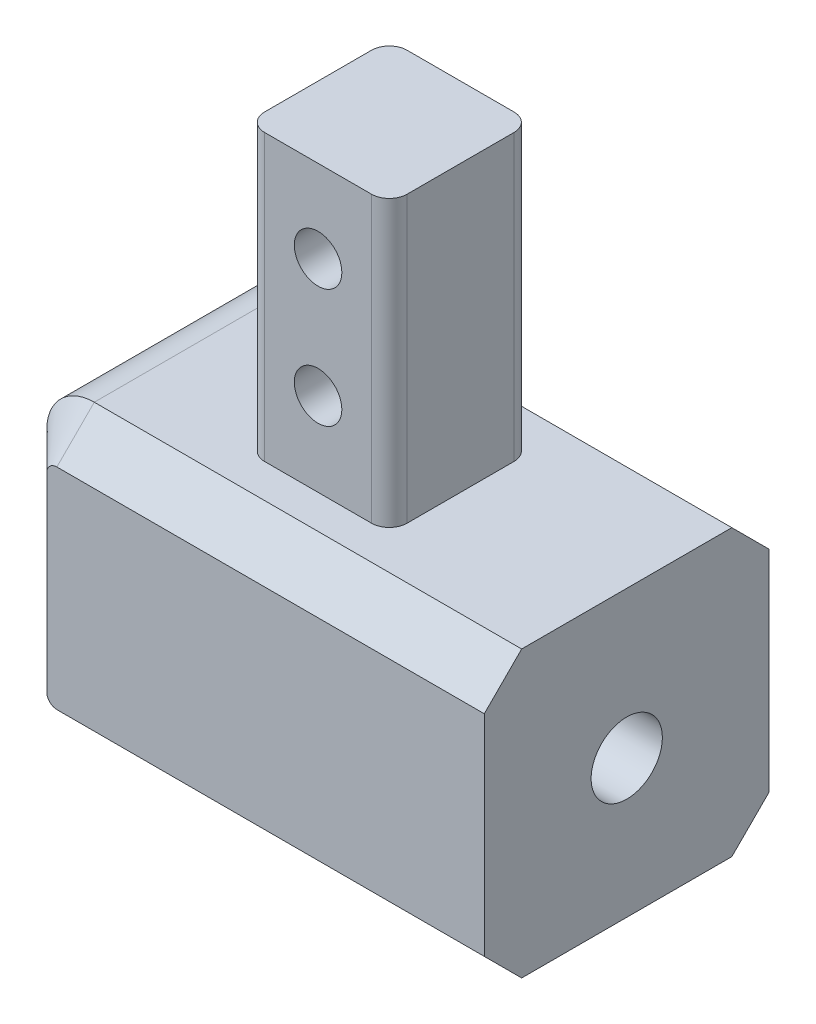
from build123d import *

# Parameters (mm, degrees)
SKETCH2_W                      = 127
SKETCH2_H                      = 76.2
BOSS_EXTRUDE2_DEPTH            = 76.2
FILLET1_R                      = 12.7
CHAMFER1_SIZE                  = 10
F_3_4_0_7500_DOWEL_HOLE1_D     = 19.05
F_3_4_0_7500_DOWEL_HOLE1_DEPTH = 76.2
F_3_4_0_7500_DOWEL_HOLE1_TIP   = 5.723197396
SKETCH9_W                      = 38.1
SKETCH9_H                      = 38.1
BOSS_EXTRUDE3_DEPTH            = 76.2
SKETCH10_R                     = 6.355
CUT_EXTRUDE1_DEPTH             = 175.711569487
FILLET3_R                      = 4.76


# Read off the part's stored shape, not the designer's step: 1/4-20 Tapped Hole1
with BuildPart() as part:
    # Sketch2 → Boss-Extrude2 (new body)
    with BuildSketch(Plane(origin=(0, 0, 0), x_dir=(1, 0, 0), z_dir=(0, 1, 0))):
        Rectangle(SKETCH2_W, SKETCH2_H)
    extrude(amount=BOSS_EXTRUDE2_DEPTH)

    # Fillet1
    fillet1_edges = [part.edges().sort_by_distance(p)[0] for p in [
        (-63.5, 76.2, 0),
        (-63.5, 0, 0),
    ]]
    fillet(fillet1_edges, radius=FILLET1_R)

    # Chamfer1
    chamfer1_edges = [part.edges().sort_by_distance(p)[0] for p in [
        (-63.5, 38.1, 38.1),
        (-63.5, 38.1, -38.1),
        (6.35, 0, 38.1),
        (6.35, 76.2, 38.1),
        (-59.780256121, 72.480256121, 38.1),
        (-59.780256121, 3.719743879, 38.1),
        (-59.780256121, 72.480256121, -38.1),
        (-59.780256121, 3.719743879, -38.1),
        (6.35, 0, -38.1),
        (6.35, 76.2, -38.1),
    ]]
    chamfer(chamfer1_edges, length=CHAMFER1_SIZE)

    # 3/4 (0.7500) Dowel Hole1
    with Locations(Plane(origin=(63.5, 0, 0), x_dir=(0, 0, -1), z_dir=(1, 0, 0))):
        with Locations((0, 36.890636669)):
            Hole(F_3_4_0_7500_DOWEL_HOLE1_D / 2, depth=F_3_4_0_7500_DOWEL_HOLE1_DEPTH)
            with Locations((0, 0, -(F_3_4_0_7500_DOWEL_HOLE1_DEPTH + F_3_4_0_7500_DOWEL_HOLE1_TIP / 2))):  # 118° drill point
                Cone(0, F_3_4_0_7500_DOWEL_HOLE1_D / 2, F_3_4_0_7500_DOWEL_HOLE1_TIP, mode=Mode.SUBTRACT)

    # 1/4-20 Tapped Hole1 outline → 1/4-20 Tapped Hole1 (revolve, cut)
    with BuildSketch(Plane(origin=(9.290251981, 0, 0), x_dir=(1, 0, 0), z_dir=(0, 0, 1))):
        Polygon((2.5527, 0), (2.5527, 27.365636669), (2.145213678, 27.610479152), (0, 27.610479152), (0, 0), align=None)
    revolve(axis=Axis((9.290251981, 0, 0), (0, 1, 0)), mode=Mode.SUBTRACT)

    # 1_4-20 Tapped Hole1 2 outline → 1_4-20 Tapped Hole1 2 (revolve, cut)
    with BuildSketch(Plane(origin=(36.474004082, 0, 0), x_dir=(1, 0, 0), z_dir=(0, 0, 1))):
        Polygon((2.5527, 0), (2.5527, 27.365636669), (2.145213678, 27.610479152), (0, 27.610479152), (0, 0), align=None)
    revolve(axis=Axis((36.474004082, 0, 0), (0, 1, 0)), mode=Mode.SUBTRACT)

    # Sketch9 → Boss-Extrude3 (add)
    with BuildSketch(Plane(origin=(0, 76.2, 0), x_dir=(1, 0, 0), z_dir=(0, 1, 0))):
        Rectangle(SKETCH9_W, SKETCH9_H)
    extrude(amount=BOSS_EXTRUDE3_DEPTH)

    # Sketch10 → Cut-Extrude1 (cut, through all)
    with BuildSketch(Plane.XY.offset(19.05)):
        with Locations((0, 98.552)):
            Circle(SKETCH10_R)
        with Locations((0, 130.302)):
            Circle(SKETCH10_R)
    extrude(amount=-CUT_EXTRUDE1_DEPTH, mode=Mode.SUBTRACT)

    # Fillet3
    fillet3_edges = [part.edges().sort_by_distance(p)[0] for p in [
        (19.05, 114.3, 19.05),
        (19.05, 114.3, -19.05),
        (-19.05, 114.3, -19.05),
        (-19.05, 114.3, 19.05),
    ]]
    fillet(fillet3_edges, radius=FILLET3_R)


solid = part.part
